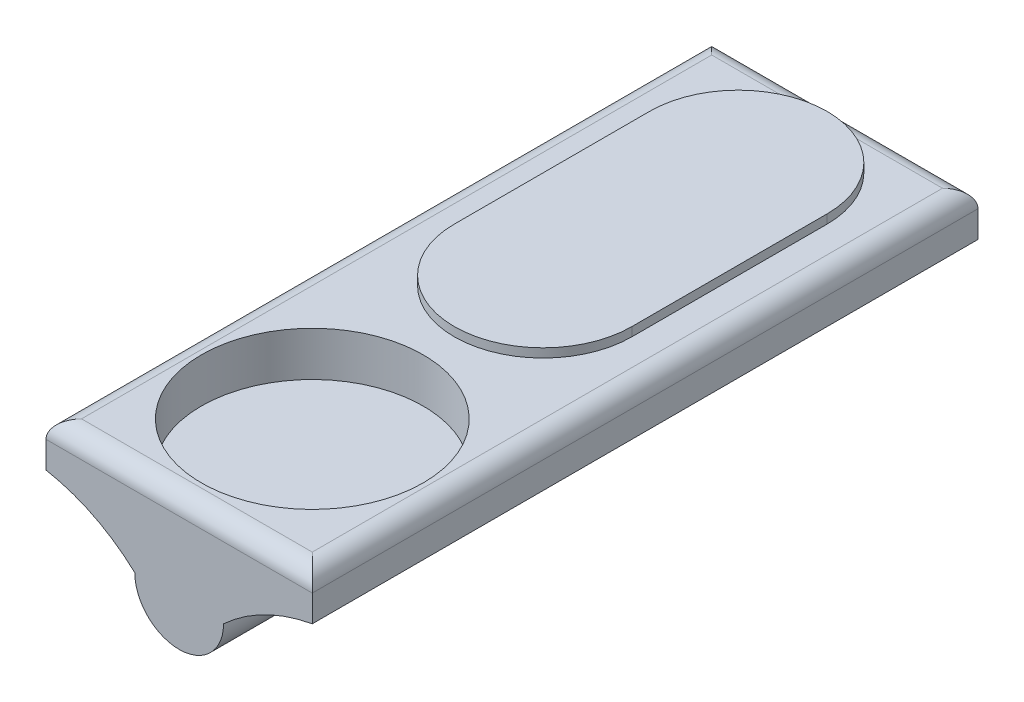
from build123d import *

# Parameters (mm, degrees)
BOSS_EXTRUDE1_DEPTH = 75
SKETCH3_R           = 4
CUT_EXTRUDE1_DEPTH  = 65
BOSS_EXTRUDE2_DEPTH = 1
SKETCH5_R           = 12.5
CUT_EXTRUDE2_DEPTH  = 5
FILLET1_R           = 2


with BuildPart() as part:
    # Sketch1 → Boss-Extrude1 (new body)
    with BuildSketch(Plane.XY):
        with BuildLine():
            Line((-15, 10), (15, 10))
            Line((15, 10), (15, 5))
            ThreePointArc((15, 5), (9.643510109, 3.212979783), (5, 0))
            ThreePointArc((5, 0), (0, -5), (-5, 0))
            ThreePointArc((-5, 0), (-9.643510109, 3.212979783), (-15, 5))
            Line((-15, 5), (-15, 10))
        make_face()
    extrude(amount=-BOSS_EXTRUDE1_DEPTH)

    # Sketch3 → Cut-Extrude1 (cut)
    with BuildSketch(Plane(origin=(0, 0, -75), x_dir=(-1, 0, 0), z_dir=(0, 0, -1))):
        Circle(SKETCH3_R)
    extrude(amount=-CUT_EXTRUDE1_DEPTH, mode=Mode.SUBTRACT)

    # Sketch4 → Boss-Extrude2 (add)
    with BuildSketch(Plane(origin=(0, 10, 0), x_dir=(1, 0, 0), z_dir=(0, 1, 0))):
        with BuildLine():
            Line((-10, 63), (-10, 41))
            ThreePointArc((-10, 41), (0, 31), (10, 41))
            Line((10, 41), (10, 63))
            ThreePointArc((10, 63), (0, 73), (-10, 63))
        make_face()
    extrude(amount=BOSS_EXTRUDE2_DEPTH)

    # Sketch5 → Cut-Extrude2 (cut)
    with BuildSketch(Plane(origin=(0, 10, 0), x_dir=(1, 0, 0), z_dir=(0, 1, 0))):
        with Locations(Location((0, 15, 0), (0, 0, 180))):
            Circle(SKETCH5_R)
    extrude(amount=-CUT_EXTRUDE2_DEPTH, mode=Mode.SUBTRACT)

    # Fillet1
    fillet1_edges = [part.edges().sort_by_distance(p)[0] for p in [
        (-15, 10, -37.5),
        (15, 10, -37.5),
        (0, 10, -75),
        (0, 10, 0),
    ]]
    fillet(fillet1_edges, radius=FILLET1_R - 0.0001)  # a hair under: the kernel refuses the full size


solid = part.part
